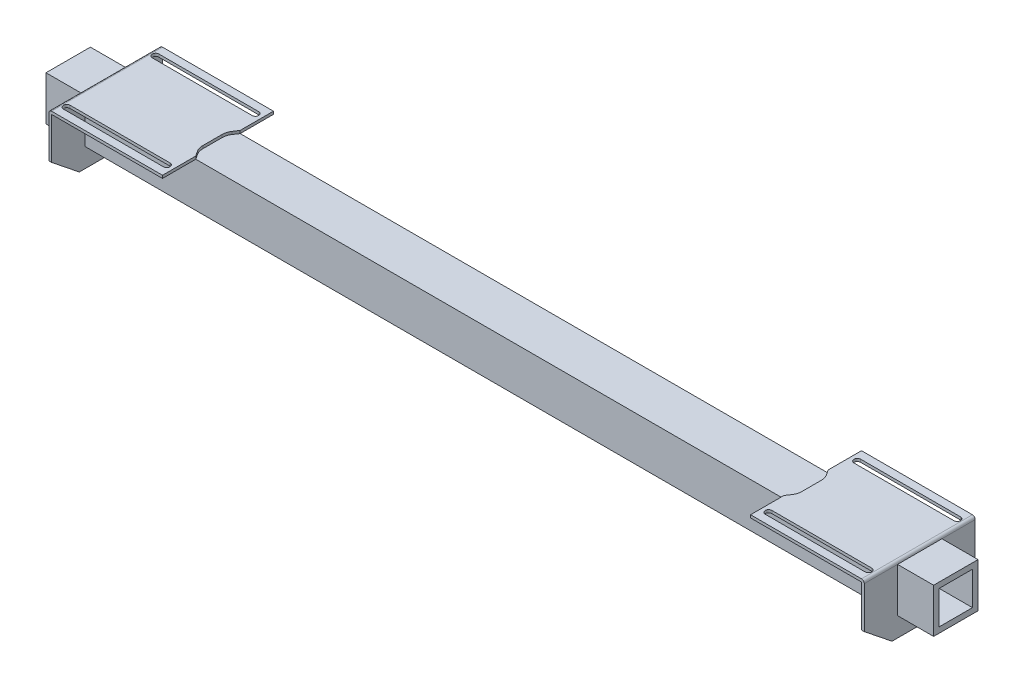
from build123d import *

# Parameters (mm, degrees)
SKETCH3_W                       = 80
SKETCH3_H                       = 80
SKETCH3_W_2                     = 60
SKETCH3_H_2                     = 60
BOSS_EXTRUDE2_DEPTH             = 1600
SKETCH7_W                       = 60
SKETCH7_H                       = 60
BOSS_EXTRUDE3_DEPTH             = 5
BOSS_EXTRUDE4_REACH             = 1610.361
SKETCH8_W                       = 205
SKETCH8_H                       = 5
BOSS_EXTRUDE4_DIRECTION_2_REACH = 1610.361
CUT_EXTRUDE1_DEPTH              = 5
CUT_EXTRUDE2_REACH              = 1612.59
FILLET1_R                       = 5
FILLET1_OF_MIRROR1_R            = 5
FILLET1_OF_MIRROR2_R            = 5


with BuildPart() as part:
    # Sketch3 → Boss-Extrude2 (new body)
    with BuildSketch(Plane(origin=(0, 0, 0), x_dir=(0, 0, -1), z_dir=(1, 0, 0))):
        with Locations((40, 40)):
            Rectangle(SKETCH3_W, SKETCH3_H)
        with Locations((40, 40)):
            Rectangle(SKETCH3_W_2, SKETCH3_H_2, mode=Mode.SUBTRACT)
    extrude(amount=BOSS_EXTRUDE2_DEPTH)

    # Sketch7 → Boss-Extrude3 (add)
    with BuildSketch(Plane(origin=(1530, 0, 0), x_dir=(0, 0, -1), z_dir=(1, 0, 0))):
        Polygon((-60, 85), (140, 85), (140, 5), (90, -35), (-10, -35), (-60, 5), align=None)
        with Locations((40, 40)):
            Rectangle(SKETCH7_W, SKETCH7_H, mode=Mode.SUBTRACT)
    boss_extrude3 = extrude(amount=BOSS_EXTRUDE3_DEPTH)

    # Boss-Extrude4: up to this face of the body (flat: up to its plane)
    boss_extrude4_end = Plane(part.part.faces().sort_by_distance((1532.5, 45, -140))[0])
    # Sketch8 → Boss-Extrude4 (add, up to the picked face)
    with BuildSketch(Plane(origin=(0, 0, -80), x_dir=(-1, 0, 0), z_dir=(0, 0, -1)), mode=Mode.PRIVATE) as boss_extrude4_sk1:
        with Locations((-1432.5, 82.5)):
            Rectangle(SKETCH8_W, SKETCH8_H)
    boss_extrude4_tool1 = split(extrude(boss_extrude4_sk1.sketch, amount=BOSS_EXTRUDE4_REACH, mode=Mode.PRIVATE), bisect_by=boss_extrude4_end, keep=Keep.BOTH, mode=Mode.PRIVATE)
    boss_extrude4 = boss_extrude4_tool1.solids().sort_by(Axis((1432.5, 82.5, -80), (0, 0, -1)))[0]
    add(boss_extrude4)

    # Boss-Extrude4 direction 2: up to this face of the body (flat: up to its plane)
    boss_extrude4_direction_2_end = Plane(part.part.faces().sort_by_distance((1532.5, 45, 60))[0])
    # Sketch8 → Boss-Extrude4 direction 2 (add, up to the picked face)
    with BuildSketch(Plane(origin=(0, 0, -80), x_dir=(-1, 0, 0), z_dir=(0, 0, -1)), mode=Mode.PRIVATE) as boss_extrude4_direction_2_sk1:
        with Locations((-1432.5, 82.5)):
            Rectangle(SKETCH8_W, SKETCH8_H)
    boss_extrude4_direction_2_tool1 = split(extrude(boss_extrude4_direction_2_sk1.sketch, amount=-BOSS_EXTRUDE4_DIRECTION_2_REACH, mode=Mode.PRIVATE), bisect_by=boss_extrude4_direction_2_end, keep=Keep.BOTH, mode=Mode.PRIVATE)
    boss_extrude4_direction_2 = boss_extrude4_direction_2_tool1.solids().sort_by(Axis((1432.5, 82.5, -80), (0, 0, 1)))[0]
    add(boss_extrude4_direction_2)

    # Sketch9 → Cut-Extrude1 (cut)
    with BuildSketch(Plane(origin=(0, 85, 0), x_dir=(1, 0, 0), z_dir=(0, 1, 0))):
        with BuildLine():
            Line((1330, 80), (1335.801257358, 71.298113962))
            ThreePointArc((1335.801257358, 71.298113962), (1338.927300662, 64.675212774), (1340, 57.430609057))
            Line((1340, 57.430609057), (1340, 22.569390943))
            ThreePointArc((1340, 22.569390943), (1338.927300662, 15.324787226), (1335.801257358, 8.701886038))
            Line((1335.801257358, 8.701886038), (1330, 0))
            Line((1330, 0), (1330, 80))
        make_face()
    cut_extrude1 = extrude(amount=-CUT_EXTRUDE1_DEPTH, mode=Mode.SUBTRACT)

    # Sketch10 → Cut-Extrude2 (cut, up to next)
    with BuildSketch(Plane(origin=(0, 85, 0), x_dir=(1, 0, 0), z_dir=(0, 1, 0)), mode=Mode.PRIVATE) as cut_extrude2_sk1:
        with BuildLine():
            Line((1342.5, 126), (1522.5, 126))
            ThreePointArc((1522.5, 126), (1528.5, 120), (1522.5, 114))
            Line((1522.5, 114), (1342.5, 114))
            ThreePointArc((1342.5, 114), (1336.5, 120), (1342.5, 126))
        make_face()
    cut_extrude2_tool1 = extrude(cut_extrude2_sk1.sketch, amount=-CUT_EXTRUDE2_REACH, mode=Mode.PRIVATE) & part.part
    # Sketch10 → Cut-Extrude2 (cut, up to next)
    with BuildSketch(Plane(origin=(0, 85, 0), x_dir=(1, 0, 0), z_dir=(0, 1, 0)), mode=Mode.PRIVATE) as cut_extrude2_sk2:
        with BuildLine():
            Line((1342.5, -34), (1522.5, -34))
            ThreePointArc((1522.5, -34), (1528.5, -40), (1522.5, -46))
            Line((1522.5, -46), (1342.5, -46))
            ThreePointArc((1342.5, -46), (1336.5, -40), (1342.5, -34))
        make_face()
    cut_extrude2_tool2 = extrude(cut_extrude2_sk2.sketch, amount=-CUT_EXTRUDE2_REACH, mode=Mode.PRIVATE) & part.part
    cut_extrude2_1 = cut_extrude2_tool1.solids().sort_by_distance((1432.5, 85, -120))[0]
    add(cut_extrude2_1, mode=Mode.SUBTRACT)
    cut_extrude2_2 = cut_extrude2_tool2.solids().sort_by_distance((1432.5, 85, 40))[0]
    add(cut_extrude2_2, mode=Mode.SUBTRACT)
    cut_extrude2 = cut_extrude2_1 + cut_extrude2_2  # Cut-Extrude2 as one shape, for the pattern or mirror that repeats it

    # Fillet1
    fillet1_edges = [part.edges().sort_by_distance(p)[0] for p in [
        (1535, 85, -40),
    ]]
    fillet(fillet1_edges, radius=FILLET1_R - 0.0001)  # a hair under: the kernel refuses the full size

    # Mirror1: Boss-Extrude3 across plane
    add(boss_extrude3.mirror(Plane(origin=(800, 0, 0), x_dir=(0, 0, 1), z_dir=(1, 0, 0))))

    # Fillet1 of Mirror1
    fillet1_of_mirror1_edges = [part.edges().sort_by_distance(p)[0] for p in [
        (65, 85, -40),
    ]]
    fillet(fillet1_of_mirror1_edges, radius=FILLET1_OF_MIRROR1_R - 0.0001)  # a hair under: the kernel refuses the full size

    # Mirror2: Boss-Extrude3, Boss-Extrude4, Boss-Extrude4 direction 2, Cut-Extrude1, Cut-Extrude2 across plane
    add(boss_extrude3.mirror(Plane(origin=(800, 0, 0), x_dir=(0, 0, 1), z_dir=(1, 0, 0))))
    add(boss_extrude4.mirror(Plane(origin=(800, 0, 0), x_dir=(0, 0, 1), z_dir=(1, 0, 0))))
    add(boss_extrude4_direction_2.mirror(Plane(origin=(800, 0, 0), x_dir=(0, 0, 1), z_dir=(1, 0, 0))))
    add(cut_extrude1.mirror(Plane(origin=(800, 0, 0), x_dir=(0, 0, 1), z_dir=(1, 0, 0))), mode=Mode.SUBTRACT)
    add(cut_extrude2.mirror(Plane(origin=(800, 0, 0), x_dir=(0, 0, 1), z_dir=(1, 0, 0))), mode=Mode.SUBTRACT)

    # Fillet1 of Mirror2
    fillet1_of_mirror2_edges = [part.edges().sort_by_distance(p)[0] for p in [
        (65, 85, -40),
    ]]
    fillet(fillet1_of_mirror2_edges, radius=FILLET1_OF_MIRROR2_R - 0.0001)  # a hair under: the kernel refuses the full size


solid = part.part
